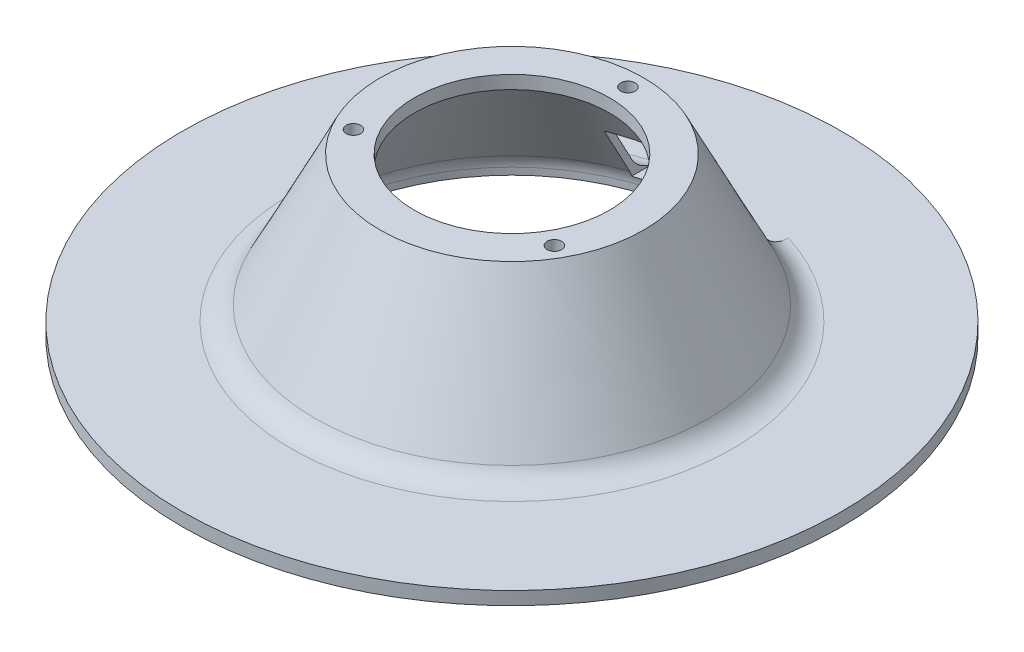
from build123d import *

# Parameters (mm, degrees)
SKETCH1_R           = 50
SKETCH1_R_2         = 2.75
SKETCH1_R_3         = 37
BOSS_EXTRUDE1_DEPTH = 5
SKETCH2_R           = 125
SKETCH2_R_2         = 75
BOSS_EXTRUDE2_DEPTH = 5
FILLET1_R           = 10
SKETCH4_W           = 50
SKETCH4_H           = 20
CUT_EXTRUDE1_DEPTH  = 186.135085845


with BuildPart() as part:
    # Sketch1 → Boss-Extrude1 (new body)
    with BuildSketch(Plane(origin=(0, 0, 0), x_dir=(1, 0, 0), z_dir=(0, 1, 0))):
        Circle(SKETCH1_R)
        with Locations((0, 44)):
            Circle(SKETCH1_R_2, mode=Mode.SUBTRACT)
        with Locations((38.105117767, -22)):
            Circle(SKETCH1_R_2, mode=Mode.SUBTRACT)
        with Locations((-38.105117767, -22)):
            Circle(SKETCH1_R_2, mode=Mode.SUBTRACT)
        Circle(SKETCH1_R_3, mode=Mode.SUBTRACT)
    extrude(amount=BOSS_EXTRUDE1_DEPTH)



with BuildPart() as body_2:
    # Sketch2 → Boss-Extrude2 (new body)
    with BuildSketch(Plane(origin=(0, -55, 0), x_dir=(1, 0, 0), z_dir=(0, 1, 0))):
        Circle(SKETCH2_R)
        Circle(SKETCH2_R_2, mode=Mode.SUBTRACT)
    extrude(amount=BOSS_EXTRUDE2_DEPTH)


with BuildPart() as part_1:
    add(part.part)

    add(body_2.part)  # Revolve1 merges body 2
    # Sketch3 → Revolve1 (revolve)
    with BuildSketch(Plane.XY):
        Polygon((-50, 0), (-75, -50), (-77.5, -50), (-50, 5), align=None)
    revolve(axis=Axis((0, 0, 0), (0, -1, 0)))

    # Fillet1
    fillet1_edges = [part_1.edges().sort_by_distance(p)[0] for p in [
        (77.5, -50, 0),
        (0, -50, 75),
    ]]
    fillet(fillet1_edges, radius=FILLET1_R)

    # Sketch4 → Cut-Extrude1 (cut, through all)
    with BuildSketch(Plane.XY):
        with Locations((0, -40)):
            Rectangle(SKETCH4_W, SKETCH4_H)
    extrude(amount=-CUT_EXTRUDE1_DEPTH, mode=Mode.SUBTRACT)


solid = part_1.part
